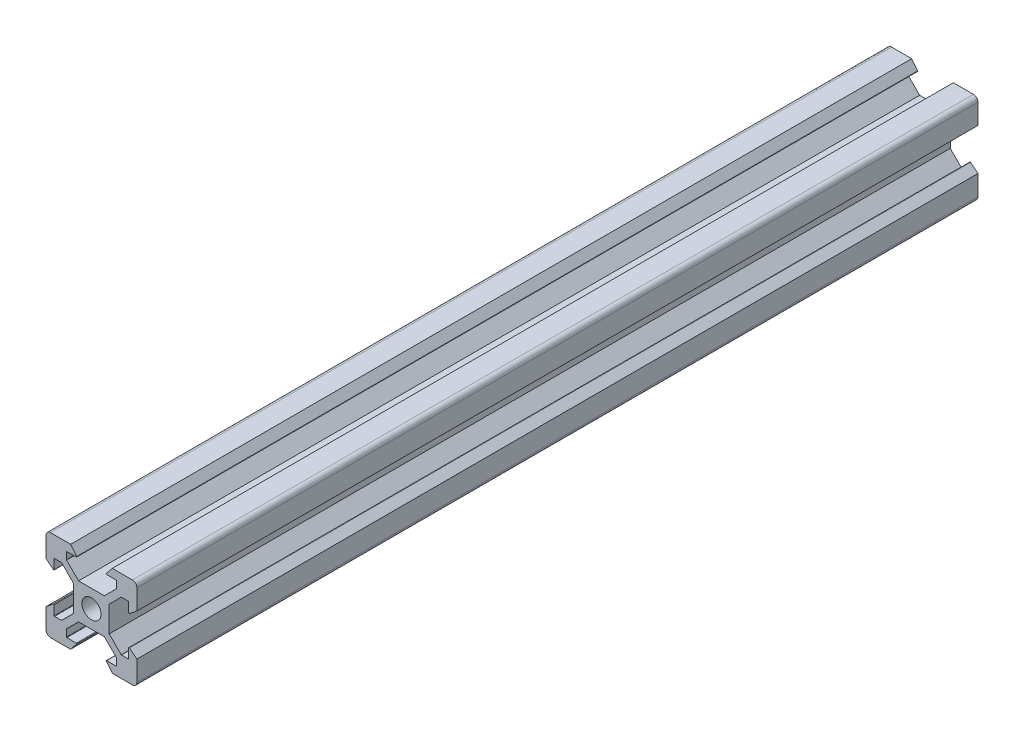
from build123d import *

# Parameters (mm, degrees)
SKETCH1_R           = 2.1
BOSS_EXTRUDE1_DEPTH = 185
FILLET1_R           = 1


with BuildPart() as part:
    # Sketch1 → Boss-Extrude1 (new body)
    with BuildSketch(Plane.XY):
        with BuildLine():
            Line((-2.839339828, 3.9), (-5.470710678, 6.53137085))
            ThreePointArc((-5.470710678, 6.53137085), (-5.492387953, 6.563813185), (-5.5, 6.602081528))
            Line((-5.5, 6.602081528), (-5.5, 8.1))
            ThreePointArc((-5.5, 8.1), (-5.470710678, 8.170710678), (-5.4, 8.2))
            Line((-5.4, 8.2), (-3.334418044, 8.2))
            ThreePointArc((-3.334418044, 8.2), (-3.244178397, 8.256909326), (-3.2566483, 8.362863876))
            Line((-3.2566483, 8.362863876), (-4.58, 10))
            Line((-4.58, 10), (-10, 10))
            Line((-10, 10), (-10, 4.58))
            Line((-10, 4.58), (-8.362863876, 3.2566483))
            ThreePointArc((-8.362863876, 3.2566483), (-8.256909326, 3.244178397), (-8.2, 3.334418044))
            Line((-8.2, 3.334418044), (-8.2, 5.4))
            ThreePointArc((-8.2, 5.4), (-8.170710678, 5.470710678), (-8.1, 5.5))
            Line((-8.1, 5.5), (-6.602081528, 5.5))
            ThreePointArc((-6.602081528, 5.5), (-6.563813185, 5.492387953), (-6.53137085, 5.470710678))
            Line((-6.53137085, 5.470710678), (-3.9, 2.839339828))
            Line((-3.9, 2.839339828), (-3.9, -2.839339828))
            Line((-3.9, -2.839339828), (-6.53137085, -5.470710678))
            ThreePointArc((-6.53137085, -5.470710678), (-6.563813185, -5.492387953), (-6.602081528, -5.5))
            Line((-6.602081528, -5.5), (-8.1, -5.5))
            ThreePointArc((-8.1, -5.5), (-8.170710678, -5.470710678), (-8.2, -5.4))
            Line((-8.2, -5.4), (-8.2, -3.334418044))
            ThreePointArc((-8.2, -3.334418044), (-8.256909326, -3.244178397), (-8.362863876, -3.2566483))
            Line((-8.362863876, -3.2566483), (-10, -4.58))
            Line((-10, -4.58), (-10, -10))
            Line((-10, -10), (-4.58, -10))
            Line((-4.58, -10), (-3.2566483, -8.362863876))
            ThreePointArc((-3.2566483, -8.362863876), (-3.244178397, -8.256909326), (-3.334418044, -8.2))
            Line((-3.334418044, -8.2), (-5.4, -8.2))
            ThreePointArc((-5.4, -8.2), (-5.470710678, -8.170710678), (-5.5, -8.1))
            Line((-5.5, -8.1), (-5.5, -6.602081528))
            ThreePointArc((-5.5, -6.602081528), (-5.492387953, -6.563813185), (-5.470710678, -6.53137085))
            Line((-5.470710678, -6.53137085), (-2.839339828, -3.9))
            Line((-2.839339828, -3.9), (2.839339828, -3.9))
            Line((2.839339828, -3.9), (5.470710678, -6.53137085))
            ThreePointArc((5.470710678, -6.53137085), (5.492387953, -6.563813185), (5.5, -6.602081528))
            Line((5.5, -6.602081528), (5.5, -8.1))
            ThreePointArc((5.5, -8.1), (5.470710678, -8.170710678), (5.4, -8.2))
            Line((5.4, -8.2), (3.334418044, -8.2))
            ThreePointArc((3.334418044, -8.2), (3.244178397, -8.256909326), (3.2566483, -8.362863876))
            Line((3.2566483, -8.362863876), (4.58, -10))
            Line((4.58, -10), (10, -10))
            Line((10, -10), (10, -4.58))
            Line((10, -4.58), (8.362863876, -3.2566483))
            ThreePointArc((8.362863876, -3.2566483), (8.256909326, -3.244178397), (8.2, -3.334418044))
            Line((8.2, -3.334418044), (8.2, -5.4))
            ThreePointArc((8.2, -5.4), (8.170710678, -5.470710678), (8.1, -5.5))
            Line((8.1, -5.5), (6.602081528, -5.5))
            ThreePointArc((6.602081528, -5.5), (6.563813185, -5.492387953), (6.53137085, -5.470710678))
            Line((6.53137085, -5.470710678), (3.9, -2.839339828))
            Line((3.9, -2.839339828), (3.9, 2.839339828))
            Line((3.9, 2.839339828), (6.53137085, 5.470710678))
            ThreePointArc((6.53137085, 5.470710678), (6.563813185, 5.492387953), (6.602081528, 5.5))
            Line((6.602081528, 5.5), (8.1, 5.5))
            ThreePointArc((8.1, 5.5), (8.170710678, 5.470710678), (8.2, 5.4))
            Line((8.2, 5.4), (8.2, 3.334418044))
            ThreePointArc((8.2, 3.334418044), (8.256909326, 3.244178397), (8.362863876, 3.2566483))
            Line((8.362863876, 3.2566483), (10, 4.58))
            Line((10, 4.58), (10, 10))
            Line((10, 10), (4.58, 10))
            Line((4.58, 10), (3.2566483, 8.362863876))
            ThreePointArc((3.2566483, 8.362863876), (3.244178397, 8.256909326), (3.334418044, 8.2))
            Line((3.334418044, 8.2), (5.4, 8.2))
            ThreePointArc((5.4, 8.2), (5.470710678, 8.170710678), (5.5, 8.1))
            Line((5.5, 8.1), (5.5, 6.602081528))
            ThreePointArc((5.5, 6.602081528), (5.492387953, 6.563813185), (5.470710678, 6.53137085))
            Line((5.470710678, 6.53137085), (2.839339828, 3.9))
            Line((2.839339828, 3.9), (-2.839339828, 3.9))
        make_face()
        Circle(SKETCH1_R, mode=Mode.SUBTRACT)
    extrude(amount=BOSS_EXTRUDE1_DEPTH)

    # Fillet1
    fillet1_edges = [part.edges().sort_by_distance(p)[0] for p in [
        (10, -10, 92.5),
        (10, 10, 92.5),
        (-10, -10, 92.5),
        (-10, 10, 92.5),
    ]]
    fillet(fillet1_edges, radius=FILLET1_R)


solid = part.part
